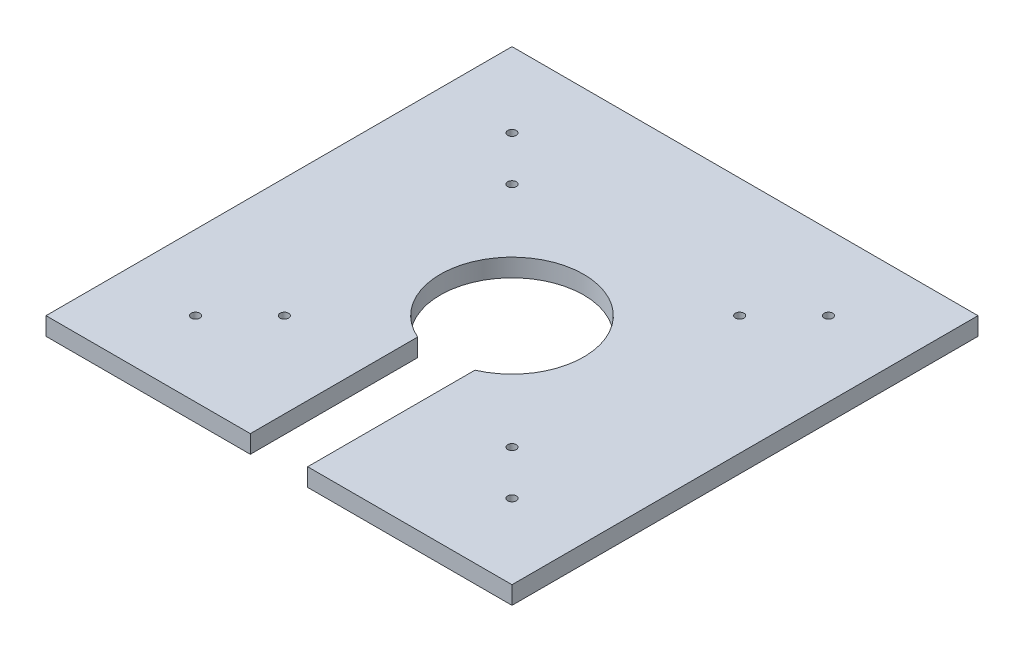
from build123d import *

# Parameters (mm, degrees)
SKETCH1_R           = 1.2
BOSS_EXTRUDE1_DEPTH = 5


with BuildPart() as part:
    # Sketch1 → Boss-Extrude1 (new body)
    with BuildSketch(Plane(origin=(0, 0, 0), x_dir=(1, 0, 0), z_dir=(0, 1, 0))):
        with BuildLine():
            Line((-98.043735541, -65), (-41.043735541, -65))
            Line((-41.043735541, -65), (-41.043735541, -18.33030278))
            ThreePointArc((-41.043735541, -18.33030278), (-33.043735541, 20), (-25.043735541, -18.33030278))
            Line((-25.043735541, -18.33030278), (-25.043735541, -65))
            Line((-25.043735541, -65), (31.956264459, -65))
            Line((31.956264459, -65), (31.956264459, 65))
            Line((31.956264459, 65), (-98.043735541, 65))
            Line((-98.043735541, 65), (-98.043735541, -65))
        make_face()
        with Locations((-77.186074413, 44.142338871)):
            Circle(SKETCH1_R, mode=Mode.SUBTRACT)
        with Locations((-64.801419905, 31.757684364)):
            Circle(SKETCH1_R, mode=Mode.SUBTRACT)
        with Locations((-1.286051177, 31.757684364)):
            Circle(SKETCH1_R, mode=Mode.SUBTRACT)
        with Locations((11.09860333, 44.142338871)):
            Circle(SKETCH1_R, mode=Mode.SUBTRACT)
        with Locations((11.09860333, -44.142338871)):
            Circle(SKETCH1_R, mode=Mode.SUBTRACT)
        with Locations((-1.286051177, -31.757684364)):
            Circle(SKETCH1_R, mode=Mode.SUBTRACT)
        with Locations((-64.801419905, -31.757684364)):
            Circle(SKETCH1_R, mode=Mode.SUBTRACT)
        with Locations((-77.186074413, -44.142338871)):
            Circle(SKETCH1_R, mode=Mode.SUBTRACT)
    extrude(amount=BOSS_EXTRUDE1_DEPTH)


solid = part.part
